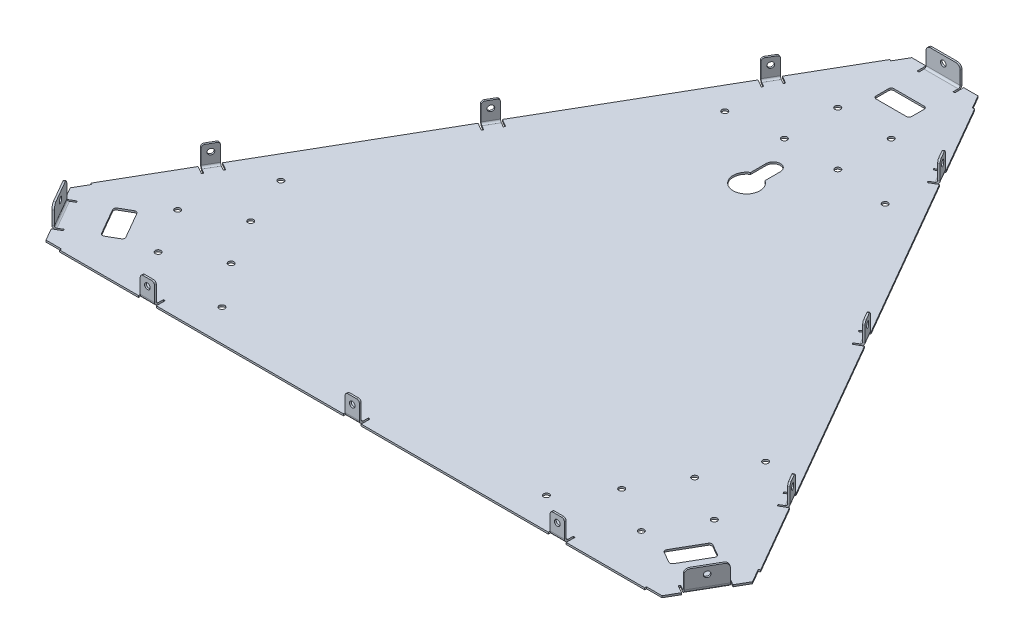
from build123d import *

# Parameters (mm, degrees)
BOSS_EXTRUDE1_DEPTH            = 1
EDGE_FLANGE1_STRIP_W           = 6.2
EDGE_FLANGE1_STRIP_H           = 1
EDGE_FLANGE1_STRIP_CUT_DEPTH   = 19.17
EDGE_FLANGE1_STRIP_2_W         = 6.2
EDGE_FLANGE1_STRIP_2_H         = 1
EDGE_FLANGE1_STRIP_CUT_2_DEPTH = 19.13
EDGE_FLANGE1_STRIP_3_W         = 6.2
EDGE_FLANGE1_STRIP_3_H         = 1
EDGE_FLANGE1_STRIP_CUT_3_DEPTH = 19.13
EDGE_FLANGE1_DEPTH             = 19.17
EDGE_FLANGE1_BEND_DEPTH        = 19.13
EDGE_FLANGE1_BEND_2_DEPTH      = 19.13
FILLET1_R                      = 2.5
EDGE_FLANGE2_STRIP_W           = 6.2
EDGE_FLANGE2_STRIP_H           = 1
EDGE_FLANGE2_STRIP_CUT_DEPTH   = 8
EDGE_FLANGE2_STRIP_2_W         = 6.2
EDGE_FLANGE2_STRIP_2_H         = 1
EDGE_FLANGE2_STRIP_CUT_2_DEPTH = 8
EDGE_FLANGE2_STRIP_3_W         = 6.2
EDGE_FLANGE2_STRIP_3_H         = 1
EDGE_FLANGE2_STRIP_CUT_3_DEPTH = 8
EDGE_FLANGE2_STRIP_4_W         = 6.2
EDGE_FLANGE2_STRIP_4_H         = 1
EDGE_FLANGE2_STRIP_CUT_4_DEPTH = 8
EDGE_FLANGE2_STRIP_5_W         = 6.2
EDGE_FLANGE2_STRIP_5_H         = 1
EDGE_FLANGE2_STRIP_CUT_5_DEPTH = 8
EDGE_FLANGE2_STRIP_6_W         = 6.2
EDGE_FLANGE2_STRIP_6_H         = 1
EDGE_FLANGE2_STRIP_CUT_6_DEPTH = 8
EDGE_FLANGE2_STRIP_7_W         = 6.2
EDGE_FLANGE2_STRIP_7_H         = 1
EDGE_FLANGE2_STRIP_CUT_7_DEPTH = 8
EDGE_FLANGE2_STRIP_8_W         = 6.2
EDGE_FLANGE2_STRIP_8_H         = 1
EDGE_FLANGE2_STRIP_CUT_8_DEPTH = 8
EDGE_FLANGE2_STRIP_9_W         = 6.2
EDGE_FLANGE2_STRIP_9_H         = 1
EDGE_FLANGE2_STRIP_CUT_9_DEPTH = 8
EDGE_FLANGE2_DEPTH             = 8
EDGE_FLANGE2_BEND_DEPTH        = 8
EDGE_FLANGE2_BEND_2_DEPTH      = 8
EDGE_FLANGE2_BEND_3_DEPTH      = 8
EDGE_FLANGE2_BEND_4_DEPTH      = 8
EDGE_FLANGE2_BEND_5_DEPTH      = 8
EDGE_FLANGE2_BEND_6_DEPTH      = 8
EDGE_FLANGE2_BEND_7_DEPTH      = 8
EDGE_FLANGE2_BEND_8_DEPTH      = 8
FILLET2_R                      = 1.5
SKETCH42_R                     = 1.6
CUT_EXTRUDE1_DEPTH             = 1
SKETCH43_R                     = 1.6
CUT_EXTRUDE2_DEPTH             = 1
SKETCH44_R                     = 1.6
CUT_EXTRUDE3_DEPTH             = 1
SKETCH45_R                     = 1.6
CUT_EXTRUDE5_DEPTH             = 10
CUT_EXTRUDE6_DEPTH             = 10
SKETCH47_R                     = 1.6
CUT_EXTRUDE7_DEPTH             = 10
SKETCH48_R                     = 1.6
CUT_EXTRUDE8_DEPTH             = 10
SKETCH49_R                     = 1.6
CUT_EXTRUDE9_DEPTH             = 10
CUT_EXTRUDE10_START            = -10
SKETCH50_R                     = 1.6
CUT_EXTRUDE10_DEPTH            = 10


# Sheet-metal steps are written as plain solids
with BuildPart() as part:
    # Sketch1 → Boss-Extrude1 (new body)
    with BuildSketch(Plane(origin=(0, 0, 0), x_dir=(1, 0, 0), z_dir=(0, 1, 0))):
        Polygon((-2.259810517, 187.062411747), (2.090189483, 194.59683276), (10.090189483, 194.59683276), (10.090189483, 189.59683276), (11.090189483, 189.59683276), (11.090189483, 194.59683276), (30.260189483, 194.59683276), (30.260189483, 189.59683276), (31.260189483, 189.59683276), (31.260189483, 194.59683276), (39.26057424, 194.59683276), (43.61057424, 187.062411747), (44.469773433, 187.558470632), (66.511269353, 149.381479823), (62.181142334, 146.881479823), (62.681142334, 146.01545442), (67.011269353, 148.51545442), (71.011269353, 141.587251189), (66.681142334, 139.087251189), (67.181142334, 138.221225786), (71.511269353, 140.721225786), (124.011269353, 49.788558388), (119.681142334, 47.288558388), (120.181142334, 46.422532984), (124.511269353, 48.922532984), (128.511269353, 41.994329754), (124.181142334, 39.494329754), (124.681142334, 38.62830435), (129.011269353, 41.12830435), (181.511269353, -49.804363047), (177.181142334, -52.304363047), (177.681142334, -53.170388451), (182.011269353, -50.670388451), (186.011269353, -57.598591681), (181.681142334, -60.098591681), (182.181142334, -60.964617085), (186.511269353, -58.464617085), (208.601269353, -96.725619424), (207.735243949, -97.225619424), (212.085243949, -104.760040437), (208.06505157, -111.723217893), (203.734924551, -109.223217893), (203.234924551, -110.089243297), (207.56505157, -112.589243297), (198.00005157, -129.156309272), (193.669924551, -126.656309272), (193.169924551, -127.522334675), (197.50005157, -130.022334675), (193.50005157, -136.950537906), (184.80005157, -136.950537906), (184.80005157, -137.950537906), (140.721610537, -137.950537906), (140.721610537, -132.952033259), (139.721610537, -132.952033259), (139.721610537, -137.950537906), (131.721610537, -137.950537906), (131.721610537, -132.952033259), (130.721610537, -132.952033259), (130.721610537, -137.950537906), (25.721610537, -137.950537906), (25.721610537, -132.952033259), (24.721610537, -132.952033259), (24.721610537, -137.950537906), (16.721610537, -137.950537906), (16.721610537, -132.952033259), (15.721610537, -132.952033259), (15.721610537, -137.950537906), (-89.278389463, -137.950537906), (-89.278389463, -132.952033259), (-90.278389463, -132.952033259), (-90.278389463, -137.950537906), (-98.278389463, -137.950537906), (-98.278389463, -132.952033259), (-99.278389463, -132.952033259), (-99.278389463, -137.950537906), (-143.458389463, -137.950537906), (-143.458389463, -136.950537906), (-152.158389463, -136.950537906), (-156.158389463, -130.022334675), (-151.828262444, -127.522334675), (-152.328262444, -126.656309272), (-156.658389463, -129.156309272), (-166.223389463, -112.589243297), (-161.893262444, -110.089243297), (-162.393262444, -109.223217893), (-166.723389463, -111.723217893), (-170.743581841, -104.760040437), (-166.393581841, -97.225619424), (-167.259607245, -96.725619424), (-145.215835921, -58.5446875), (-140.885708902, -61.0446875), (-140.385708902, -60.178662097), (-144.715835921, -57.678662097), (-140.715835921, -50.750458866), (-136.385708902, -53.250458866), (-135.885708902, -52.384433463), (-140.215835921, -49.884433463), (-87.715835921, 41.048233935), (-83.385708902, 38.548233935), (-82.885708902, 39.414259339), (-87.215835921, 41.914259339), (-83.215835921, 48.842462569), (-78.885708902, 46.342462569), (-78.385708902, 47.208487973), (-82.715835921, 49.708487973), (-30.215835921, 140.64115537), (-25.885708902, 138.14115537), (-25.385708902, 139.007180774), (-29.715835921, 141.507180774), (-25.715835921, 148.435384004), (-21.385708902, 145.935384004), (-20.885708902, 146.801409408), (-25.215835921, 149.301409408), (-3.125835921, 187.562411747), align=None)
    extrude(amount=BOSS_EXTRUDE1_DEPTH)

    # Edge-Flange1 strip (across the edge) → Edge-Flange1 strip cut (cut)
    with BuildSketch(Plane(origin=(30.260189483, 1, -194.59683276), x_dir=(0, 0, 1), z_dir=(-1, 0, 0))):
        with Locations((-1, -0.5)):
            Rectangle(EDGE_FLANGE1_STRIP_W, EDGE_FLANGE1_STRIP_H)
    extrude(amount=EDGE_FLANGE1_STRIP_CUT_DEPTH, mode=Mode.SUBTRACT)

    # Edge-Flange1 strip 2 (across the edge) → Edge-Flange1 strip cut 2 (cut)
    with BuildSketch(Plane(origin=(198.00005157, 1, 129.156309272), x_dir=(-0.866025403784439, 3.491481338843133e-15, -0.4999999999999995), z_dir=(0.4999999999999995, 0, -0.866025403784439))):
        with Locations((-1, -0.5)):
            Rectangle(EDGE_FLANGE1_STRIP_2_W, EDGE_FLANGE1_STRIP_2_H)
    extrude(amount=EDGE_FLANGE1_STRIP_CUT_2_DEPTH, mode=Mode.SUBTRACT)

    # Edge-Flange1 strip 3 (across the edge) → Edge-Flange1 strip cut 3 (cut)
    with BuildSketch(Plane(origin=(-166.223389463, 1, 112.589243297), x_dir=(0.8660254037844379, 3.4914813388431334e-15, -0.5000000000000012), z_dir=(0.5000000000000012, 0, 0.8660254037844379))):
        with Locations((-1, -0.5)):
            Rectangle(EDGE_FLANGE1_STRIP_3_W, EDGE_FLANGE1_STRIP_3_H)
    extrude(amount=EDGE_FLANGE1_STRIP_CUT_3_DEPTH, mode=Mode.SUBTRACT)

    # Edge-Flange1 section (across the edge) → Edge-Flange1 (add)
    with BuildSketch(Plane(origin=(30.260189483, 1, -194.59683276), x_dir=(0, 0, 1), z_dir=(-1, 0, 0))):
        with BuildLine():
            Line((0, 1.1), (0, 11))
            Line((0, 11), (1, 11))
            Line((1, 11), (1, 1.1))
            ThreePointArc((1, 1.1), (1.322182541, 0.322182541), (2.1, 0))
            Line((2.1, 0), (2.1, -1))
            ThreePointArc((2.1, -1), (0.61507576, -0.38492424), (0, 1.1))
        make_face()
    extrude(amount=EDGE_FLANGE1_DEPTH)

    # Edge-Flange1 section 2 (across the edge) → Edge-Flange1 bend (add)
    with BuildSketch(Plane(origin=(198.00005157, 1, 129.156309272), x_dir=(-0.866025403784439, 3.491481338843133e-15, -0.4999999999999995), z_dir=(0.4999999999999995, 0, -0.866025403784439))):
        with BuildLine():
            Line((0, 1.1), (0, 11))
            Line((0, 11), (1, 11))
            Line((1, 11), (1, 1.1))
            ThreePointArc((1, 1.1), (1.322182541, 0.322182541), (2.1, 0))
            Line((2.1, 0), (2.1, -1))
            ThreePointArc((2.1, -1), (0.61507576, -0.38492424), (0, 1.1))
        make_face()
    extrude(amount=EDGE_FLANGE1_BEND_DEPTH)

    # Edge-Flange1 section 3 (across the edge) → Edge-Flange1 bend 2 (add)
    with BuildSketch(Plane(origin=(-166.223389463, 1, 112.589243297), x_dir=(0.8660254037844379, 3.4914813388431334e-15, -0.5000000000000012), z_dir=(0.5000000000000012, 0, 0.8660254037844379))):
        with BuildLine():
            Line((0, 1.1), (0, 11))
            Line((0, 11), (1, 11))
            Line((1, 11), (1, 1.1))
            ThreePointArc((1, 1.1), (1.322182541, 0.322182541), (2.1, 0))
            Line((2.1, 0), (2.1, -1))
            ThreePointArc((2.1, -1), (0.61507576, -0.38492424), (0, 1.1))
        make_face()
    extrude(amount=EDGE_FLANGE1_BEND_2_DEPTH)

    # Fillet1
    fillet1_edges = [part.edges().sort_by_distance(p)[0] for p in [
        (30.260189483, 12, -194.09683276),
        (11.090189483, 12, -194.09683276),
        (197.567038868, 12, 128.906309272),
        (207.132038868, 12, 112.339243297),
        (-165.790376761, 12, 112.339243297),
        (-156.225376761, 12, 128.906309272),
    ]]
    fillet(fillet1_edges, radius=FILLET1_R)

    # Edge-Flange2 strip (across the edge) → Edge-Flange2 strip cut (cut)
    with BuildSketch(Plane(origin=(-98.278389463, 1, 137.950537906), x_dir=(0, 0, -1), z_dir=(1, 0, 0))):
        with Locations((-1, -0.5)):
            Rectangle(EDGE_FLANGE2_STRIP_W, EDGE_FLANGE2_STRIP_H)
    extrude(amount=EDGE_FLANGE2_STRIP_CUT_DEPTH, mode=Mode.SUBTRACT)

    # Edge-Flange2 strip 2 (across the edge) → Edge-Flange2 strip cut 2 (cut)
    with BuildSketch(Plane(origin=(16.721610537, 1, 137.950537906), x_dir=(0, 0, -1), z_dir=(1, 0, 0))):
        with Locations((-1, -0.5)):
            Rectangle(EDGE_FLANGE2_STRIP_2_W, EDGE_FLANGE2_STRIP_2_H)
    extrude(amount=EDGE_FLANGE2_STRIP_CUT_2_DEPTH, mode=Mode.SUBTRACT)

    # Edge-Flange2 strip 3 (across the edge) → Edge-Flange2 strip cut 3 (cut)
    with BuildSketch(Plane(origin=(131.721610537, 1, 137.950537906), x_dir=(0, 0, -1), z_dir=(1, 0, 0))):
        with Locations((-1, -0.5)):
            Rectangle(EDGE_FLANGE2_STRIP_3_W, EDGE_FLANGE2_STRIP_3_H)
    extrude(amount=EDGE_FLANGE2_STRIP_CUT_3_DEPTH, mode=Mode.SUBTRACT)

    # Edge-Flange2 strip 4 (across the edge) → Edge-Flange2 strip cut 4 (cut)
    with BuildSketch(Plane(origin=(186.011269353, 1, 57.598591681), x_dir=(-0.8660254037844403, 3.4914813388431334e-15, 0.4999999999999975), z_dir=(-0.4999999999999975, 0, -0.8660254037844403))):
        with Locations((-1, -0.5)):
            Rectangle(EDGE_FLANGE2_STRIP_4_W, EDGE_FLANGE2_STRIP_4_H)
    extrude(amount=EDGE_FLANGE2_STRIP_CUT_4_DEPTH, mode=Mode.SUBTRACT)

    # Edge-Flange2 strip 5 (across the edge) → Edge-Flange2 strip cut 5 (cut)
    with BuildSketch(Plane(origin=(128.511269353, 1, -41.994329754), x_dir=(-0.8660254037844394, 3.5155183724229278e-15, 0.4999999999999987), z_dir=(-0.4999999999999987, 0, -0.8660254037844394))):
        with Locations((-1, -0.5)):
            Rectangle(EDGE_FLANGE2_STRIP_5_W, EDGE_FLANGE2_STRIP_5_H)
    extrude(amount=EDGE_FLANGE2_STRIP_CUT_5_DEPTH, mode=Mode.SUBTRACT)

    # Edge-Flange2 strip 6 (across the edge) → Edge-Flange2 strip cut 6 (cut)
    with BuildSketch(Plane(origin=(71.011269353, 1, -141.587251189), x_dir=(-0.8660254037844404, 3.4914813388431334e-15, 0.4999999999999973), z_dir=(-0.4999999999999973, 0, -0.8660254037844404))):
        with Locations((-1, -0.5)):
            Rectangle(EDGE_FLANGE2_STRIP_6_W, EDGE_FLANGE2_STRIP_6_H)
    extrude(amount=EDGE_FLANGE2_STRIP_CUT_6_DEPTH, mode=Mode.SUBTRACT)

    # Edge-Flange2 strip 7 (across the edge) → Edge-Flange2 strip cut 7 (cut)
    with BuildSketch(Plane(origin=(-25.715835921, 1, -148.435384004), x_dir=(0.8660254037844387, 3.491481338843133e-15, 0.5000000000000001), z_dir=(-0.5000000000000001, 0, 0.8660254037844387))):
        with Locations((-1, -0.5)):
            Rectangle(EDGE_FLANGE2_STRIP_7_W, EDGE_FLANGE2_STRIP_7_H)
    extrude(amount=EDGE_FLANGE2_STRIP_CUT_7_DEPTH, mode=Mode.SUBTRACT)

    # Edge-Flange2 strip 8 (across the edge) → Edge-Flange2 strip cut 8 (cut)
    with BuildSketch(Plane(origin=(-83.215835921, 1, -48.842462569), x_dir=(0.8660254037844392, 3.4914813388431334e-15, 0.4999999999999991), z_dir=(-0.4999999999999991, 0, 0.8660254037844392))):
        with Locations((-1, -0.5)):
            Rectangle(EDGE_FLANGE2_STRIP_8_W, EDGE_FLANGE2_STRIP_8_H)
    extrude(amount=EDGE_FLANGE2_STRIP_CUT_8_DEPTH, mode=Mode.SUBTRACT)

    # Edge-Flange2 strip 9 (across the edge) → Edge-Flange2 strip cut 9 (cut)
    with BuildSketch(Plane(origin=(-140.715835921, 1, 50.750458866), x_dir=(0.8660254037844387, 3.4914813388431334e-15, 0.5000000000000001), z_dir=(-0.5000000000000001, 0, 0.8660254037844387))):
        with Locations((-1, -0.5)):
            Rectangle(EDGE_FLANGE2_STRIP_9_W, EDGE_FLANGE2_STRIP_9_H)
    extrude(amount=EDGE_FLANGE2_STRIP_CUT_9_DEPTH, mode=Mode.SUBTRACT)

    # Edge-Flange2 section (across the edge) → Edge-Flange2 (add)
    with BuildSketch(Plane(origin=(-98.278389463, 1, 137.950537906), x_dir=(0, 0, -1), z_dir=(1, 0, 0))):
        with BuildLine():
            Line((0, 1.1), (0, 11))
            Line((0, 11), (1, 11))
            Line((1, 11), (1, 1.1))
            ThreePointArc((1, 1.1), (1.322182541, 0.322182541), (2.1, 0))
            Line((2.1, 0), (2.1, -1))
            ThreePointArc((2.1, -1), (0.61507576, -0.38492424), (0, 1.1))
        make_face()
    extrude(amount=EDGE_FLANGE2_DEPTH)

    # Edge-Flange2 section 2 (across the edge) → Edge-Flange2 bend (add)
    with BuildSketch(Plane(origin=(16.721610537, 1, 137.950537906), x_dir=(0, 0, -1), z_dir=(1, 0, 0))):
        with BuildLine():
            Line((0, 1.1), (0, 11))
            Line((0, 11), (1, 11))
            Line((1, 11), (1, 1.1))
            ThreePointArc((1, 1.1), (1.322182541, 0.322182541), (2.1, 0))
            Line((2.1, 0), (2.1, -1))
            ThreePointArc((2.1, -1), (0.61507576, -0.38492424), (0, 1.1))
        make_face()
    extrude(amount=EDGE_FLANGE2_BEND_DEPTH)

    # Edge-Flange2 section 3 (across the edge) → Edge-Flange2 bend 2 (add)
    with BuildSketch(Plane(origin=(131.721610537, 1, 137.950537906), x_dir=(0, 0, -1), z_dir=(1, 0, 0))):
        with BuildLine():
            Line((0, 1.1), (0, 11))
            Line((0, 11), (1, 11))
            Line((1, 11), (1, 1.1))
            ThreePointArc((1, 1.1), (1.322182541, 0.322182541), (2.1, 0))
            Line((2.1, 0), (2.1, -1))
            ThreePointArc((2.1, -1), (0.61507576, -0.38492424), (0, 1.1))
        make_face()
    extrude(amount=EDGE_FLANGE2_BEND_2_DEPTH)

    # Edge-Flange2 section 4 (across the edge) → Edge-Flange2 bend 3 (add)
    with BuildSketch(Plane(origin=(186.011269353, 1, 57.598591681), x_dir=(-0.8660254037844403, 3.4914813388431334e-15, 0.4999999999999975), z_dir=(-0.4999999999999975, 0, -0.8660254037844403))):
        with BuildLine():
            Line((0, 1.1), (0, 11))
            Line((0, 11), (1, 11))
            Line((1, 11), (1, 1.1))
            ThreePointArc((1, 1.1), (1.322182541, 0.322182541), (2.1, 0))
            Line((2.1, 0), (2.1, -1))
            ThreePointArc((2.1, -1), (0.61507576, -0.38492424), (0, 1.1))
        make_face()
    extrude(amount=EDGE_FLANGE2_BEND_3_DEPTH)

    # Edge-Flange2 section 5 (across the edge) → Edge-Flange2 bend 4 (add)
    with BuildSketch(Plane(origin=(128.511269353, 1, -41.994329754), x_dir=(-0.8660254037844394, 3.5155183724229278e-15, 0.4999999999999987), z_dir=(-0.4999999999999987, 0, -0.8660254037844394))):
        with BuildLine():
            Line((0, 1.1), (0, 11))
            Line((0, 11), (1, 11))
            Line((1, 11), (1, 1.1))
            ThreePointArc((1, 1.1), (1.322182541, 0.322182541), (2.1, 0))
            Line((2.1, 0), (2.1, -1))
            ThreePointArc((2.1, -1), (0.61507576, -0.38492424), (0, 1.1))
        make_face()
    extrude(amount=EDGE_FLANGE2_BEND_4_DEPTH)

    # Edge-Flange2 section 6 (across the edge) → Edge-Flange2 bend 5 (add)
    with BuildSketch(Plane(origin=(71.011269353, 1, -141.587251189), x_dir=(-0.8660254037844404, 3.4914813388431334e-15, 0.4999999999999973), z_dir=(-0.4999999999999973, 0, -0.8660254037844404))):
        with BuildLine():
            Line((0, 1.1), (0, 11))
            Line((0, 11), (1, 11))
            Line((1, 11), (1, 1.1))
            ThreePointArc((1, 1.1), (1.322182541, 0.322182541), (2.1, 0))
            Line((2.1, 0), (2.1, -1))
            ThreePointArc((2.1, -1), (0.61507576, -0.38492424), (0, 1.1))
        make_face()
    extrude(amount=EDGE_FLANGE2_BEND_5_DEPTH)

    # Edge-Flange2 section 7 (across the edge) → Edge-Flange2 bend 6 (add)
    with BuildSketch(Plane(origin=(-25.715835921, 1, -148.435384004), x_dir=(0.8660254037844387, 3.491481338843133e-15, 0.5000000000000001), z_dir=(-0.5000000000000001, 0, 0.8660254037844387))):
        with BuildLine():
            Line((0, 1.1), (0, 11))
            Line((0, 11), (1, 11))
            Line((1, 11), (1, 1.1))
            ThreePointArc((1, 1.1), (1.322182541, 0.322182541), (2.1, 0))
            Line((2.1, 0), (2.1, -1))
            ThreePointArc((2.1, -1), (0.61507576, -0.38492424), (0, 1.1))
        make_face()
    extrude(amount=EDGE_FLANGE2_BEND_6_DEPTH)

    # Edge-Flange2 section 8 (across the edge) → Edge-Flange2 bend 7 (add)
    with BuildSketch(Plane(origin=(-83.215835921, 1, -48.842462569), x_dir=(0.8660254037844392, 3.4914813388431334e-15, 0.4999999999999991), z_dir=(-0.4999999999999991, 0, 0.8660254037844392))):
        with BuildLine():
            Line((0, 1.1), (0, 11))
            Line((0, 11), (1, 11))
            Line((1, 11), (1, 1.1))
            ThreePointArc((1, 1.1), (1.322182541, 0.322182541), (2.1, 0))
            Line((2.1, 0), (2.1, -1))
            ThreePointArc((2.1, -1), (0.61507576, -0.38492424), (0, 1.1))
        make_face()
    extrude(amount=EDGE_FLANGE2_BEND_7_DEPTH)

    # Edge-Flange2 section 9 (across the edge) → Edge-Flange2 bend 8 (add)
    with BuildSketch(Plane(origin=(-140.715835921, 1, 50.750458866), x_dir=(0.8660254037844387, 3.4914813388431334e-15, 0.5000000000000001), z_dir=(-0.5000000000000001, 0, 0.8660254037844387))):
        with BuildLine():
            Line((0, 1.1), (0, 11))
            Line((0, 11), (1, 11))
            Line((1, 11), (1, 1.1))
            ThreePointArc((1, 1.1), (1.322182541, 0.322182541), (2.1, 0))
            Line((2.1, 0), (2.1, -1))
            ThreePointArc((2.1, -1), (0.61507576, -0.38492424), (0, 1.1))
        make_face()
    extrude(amount=EDGE_FLANGE2_BEND_8_DEPTH)

    # Fillet2
    fillet2_edges = [part.edges().sort_by_distance(p)[0] for p in [
        (-98.278389463, 12, 137.450537906),
        (-90.278389463, 12, 137.450537906),
        (16.721610537, 12, 137.450537906),
        (24.721610537, 12, 137.450537906),
        (131.721610537, 12, 137.450537906),
        (139.721610537, 12, 137.450537906),
        (185.578256651, 12, 57.848591681),
        (181.578256651, 12, 50.920388451),
        (128.078256651, 12, -41.744329754),
        (124.078256651, 12, -48.672532984),
        (70.578256651, 12, -141.337251189),
        (66.578256651, 12, -148.26545442),
        (-25.282823219, 12, -148.185384004),
        (-29.282823219, 12, -141.257180774),
        (-82.782823219, 12, -48.592462569),
        (-86.782823219, 12, -41.664259339),
        (-140.282823219, 12, 51.000458866),
        (-144.282823219, 12, 57.928662097),
    ]]
    fillet(fillet2_edges, radius=FILLET2_R)

    # Sketch42 → Cut-Extrude1 (cut)
    with BuildSketch(Plane(origin=(-83.561283625, 0, -48.244129595), x_dir=(-0.4999999999999998, -2.2078298785159348e-15, 0.8660254037844388), z_dir=(-0.8660254037844388, -3.824073524058226e-15, -0.4999999999999998))):
        with Locations((-111.690895407, 8)):
            Circle(SKETCH42_R)
        with Locations((3.309104593, 8)):
            Circle(SKETCH42_R)
        with Locations((118.309104593, 8)):
            Circle(SKETCH42_R)
    extrude(amount=-CUT_EXTRUDE1_DEPTH, mode=Mode.SUBTRACT)

    # Sketch43 → Cut-Extrude2 (cut)
    with BuildSketch(Plane.XY.offset(137.950537906)):
        with Locations((-94.278389463, 8)):
            Circle(SKETCH43_R)
        with Locations((20.721610537, 8)):
            Circle(SKETCH43_R)
        with Locations((135.721610537, 8)):
            Circle(SKETCH43_R)
    extrude(amount=-CUT_EXTRUDE2_DEPTH, mode=Mode.SUBTRACT)

    # Sketch44 → Cut-Extrude3 (cut)
    with BuildSketch(Plane(origin=(114.567530206, 0, -66.145594405), x_dir=(-0.4999999999999941, 0, -0.866025403784442), z_dir=(0.8660254037844421, 0, -0.49999999999999417))):
        with Locations((-138.887478295, 8)):
            Circle(SKETCH44_R)
        with Locations((-23.887478295, 8)):
            Circle(SKETCH44_R)
        with Locations((91.112521705, 8)):
            Circle(SKETCH44_R)
    extrude(amount=-CUT_EXTRUDE3_DEPTH, mode=Mode.SUBTRACT)

    # Sketch45 → Cut-Extrude5 (cut)
    with BuildSketch(Plane.XZ):
        with Locations(Location((-70.194965114, 120.153437839, 0), (0, 0, 270))):
            Circle(SKETCH45_R)
        with Locations(Location((-115.122545292, 42.168524484, 0), (0, 0, 270))):
            Circle(SKETCH45_R)
        with Locations(Location((112.313067381, 120.601717501, 0), (0, 0, 270))):
            Circle(SKETCH45_R)
        with Locations(Location((157.386266961, 42.700875911, 0), (0, 0, 270))):
            Circle(SKETCH45_R)
        with Locations(Location((-24.324810517, -116.08616962, 0), (0, 0, 270))):
            Circle(SKETCH45_R)
        with Locations(Location((65.675189483, -116.08616962, 0), (0, 0, 270))):
            Circle(SKETCH45_R)
        with BuildLine():
            Line((20.675189483, -102.28616962), (20.675189483, -93.63045839))
            ThreePointArc((20.675189483, -93.63045839), (16.675189483, -79.78616962), (12.675189483, -93.63045839))
            Line((12.675189483, -93.63045839), (12.675189483, -102.28616962))
            ThreePointArc((12.675189483, -102.28616962), (16.675189483, -106.28616962), (20.675189483, -102.28616962))
        make_face()
    extrude(amount=-CUT_EXTRUDE5_DEPTH, mode=Mode.SUBTRACT)

    # Sketch46 → Cut-Extrude6 (cut)
    with BuildSketch(Plane(origin=(0, 0, 0), x_dir=(-1, 0, 0), z_dir=(0, -1, 0))):
        with BuildLine():
            Line((148.283778847, -103.461560352), (139.783778847, -118.183992217))
            ThreePointArc((139.783778847, -118.183992217), (138.872969309, -118.882880956), (137.734740741, -118.733030322))
            Line((137.734740741, -118.733030322), (131.672562914, -115.233030322))
            ThreePointArc((131.672562914, -115.233030322), (130.973674175, -114.322220784), (131.123524809, -113.183992217))
            Line((131.123524809, -113.183992217), (139.623524809, -98.461560352))
            ThreePointArc((139.623524809, -98.461560352), (140.534334347, -97.762671613), (141.672562914, -97.912522247))
            Line((141.672562914, -97.912522247), (147.734740741, -101.412522247))
            ThreePointArc((147.734740741, -101.412522247), (148.43362948, -102.323331785), (148.283778847, -103.461560352))
        make_face()
        with BuildLine():
            Line((-189.625440954, -103.461560352), (-181.125440954, -118.183992217))
            ThreePointArc((-181.125440954, -118.183992217), (-180.214631416, -118.882880956), (-179.076402849, -118.733030322))
            Line((-179.076402849, -118.733030322), (-173.014225022, -115.233030322))
            ThreePointArc((-173.014225022, -115.233030322), (-172.315336283, -114.322220784), (-172.465186916, -113.183992217))
            Line((-172.465186916, -113.183992217), (-180.965186916, -98.461560352))
            ThreePointArc((-180.965186916, -98.461560352), (-181.875996454, -97.762671613), (-183.014225022, -97.912522247))
            Line((-183.014225022, -97.912522247), (-189.076402849, -101.412522247))
            ThreePointArc((-189.076402849, -101.412522247), (-189.775291588, -102.323331785), (-189.625440954, -103.461560352))
        make_face()
        with BuildLine():
            Line((-30.675189483, 172.99683276), (-30.675189483, 165.99683276))
            ThreePointArc((-30.675189483, 165.99683276), (-30.235849654, 164.936172588), (-29.175189483, 164.49683276))
            Line((-29.175189483, 164.49683276), (-12.175189483, 164.49683276))
            ThreePointArc((-12.175189483, 164.49683276), (-11.114529311, 164.936172588), (-10.675189483, 165.99683276))
            Line((-10.675189483, 165.99683276), (-10.675189483, 172.99683276))
            ThreePointArc((-10.675189483, 172.99683276), (-11.114529311, 174.057492932), (-12.175189483, 174.49683276))
            Line((-12.175189483, 174.49683276), (-29.175189483, 174.49683276))
            ThreePointArc((-29.175189483, 174.49683276), (-30.235849654, 174.057492932), (-30.675189483, 172.99683276))
        make_face()
    extrude(amount=-CUT_EXTRUDE6_DEPTH, mode=Mode.SUBTRACT)

    # Sketch47 → Cut-Extrude7 (cut)
    with BuildSketch(Plane.XZ):
        with Locations(Location((5.675189483, -119.49683276, 0), (0, 0, 270))):
            Circle(SKETCH47_R)
        with Locations(Location((35.675189483, -119.49683276, 0), (0, 0, 270))):
            Circle(SKETCH47_R)
        with Locations(Location((35.675189483, -149.49683276, 0), (0, 0, 270))):
            Circle(SKETCH47_R)
        with Locations(Location((5.675189483, -149.49683276, 0), (0, 0, 270))):
            Circle(SKETCH47_R)
        with Locations(Location((156.22480586, 111.313157341, 0), (0, 0, 270))):
            Circle(SKETCH47_R)
        with Locations(Location((171.22480586, 85.332395228, 0), (0, 0, 270))):
            Circle(SKETCH47_R)
        with Locations(Location((145.244043746, 70.332395228, 0), (0, 0, 270))):
            Circle(SKETCH47_R)
        with Locations(Location((130.244043746, 96.313157341, 0), (0, 0, 270))):
            Circle(SKETCH47_R)
        with Locations(Location((-114.883143752, 111.313157341, 0), (0, 0, 270))):
            Circle(SKETCH47_R)
        with Locations(Location((-88.902381638, 96.313157341, 0), (0, 0, 270))):
            Circle(SKETCH47_R)
        with Locations(Location((-103.902381638, 70.332395228, 0), (0, 0, 270))):
            Circle(SKETCH47_R)
        with Locations(Location((-129.883143752, 85.332395228, 0), (0, 0, 270))):
            Circle(SKETCH47_R)
    extrude(amount=-CUT_EXTRUDE7_DEPTH, mode=Mode.SUBTRACT)

    # Sketch48 → Cut-Extrude8 (cut)
    with BuildSketch(Plane(origin=(-173.420114541, 0, 100.124149813), x_dir=(0.5000000000000012, 1.990012030401156e-15, 0.866025403784438), z_dir=(-0.866025403784438, -3.4468019443280924e-15, 0.5000000000000012))):
        with Locations((23.958450157, 8)):
            Circle(SKETCH48_R)
    extrude(amount=-CUT_EXTRUDE8_DEPTH, mode=Mode.SUBTRACT)

    # Sketch49 → Cut-Extrude9 (cut)
    with BuildSketch(Plane(origin=(204.426361122, 0, 118.025614623), x_dir=(0.5000000000000004, -1.2616170734376786e-15, -0.8660254037844384), z_dir=(0.8660254037844384, -2.1851848708904134e-15, 0.5000000000000004))):
        with Locations((-3.287619103, 8)):
            Circle(SKETCH49_R)
    extrude(amount=-CUT_EXTRUDE9_DEPTH, mode=Mode.SUBTRACT)

    # Sketch50 → Cut-Extrude10 (cut)
    with BuildSketch(Plane(origin=(0, 0, -194.59683276), x_dir=(-1, 0, 0), z_dir=(0, 0, -1)).offset(CUT_EXTRUDE10_START)):
        with Locations(Location((-20.721610537, 8, 0), (0, 0, 180))):
            Circle(SKETCH50_R)
    extrude(amount=CUT_EXTRUDE10_DEPTH, mode=Mode.SUBTRACT)


solid = part.part
